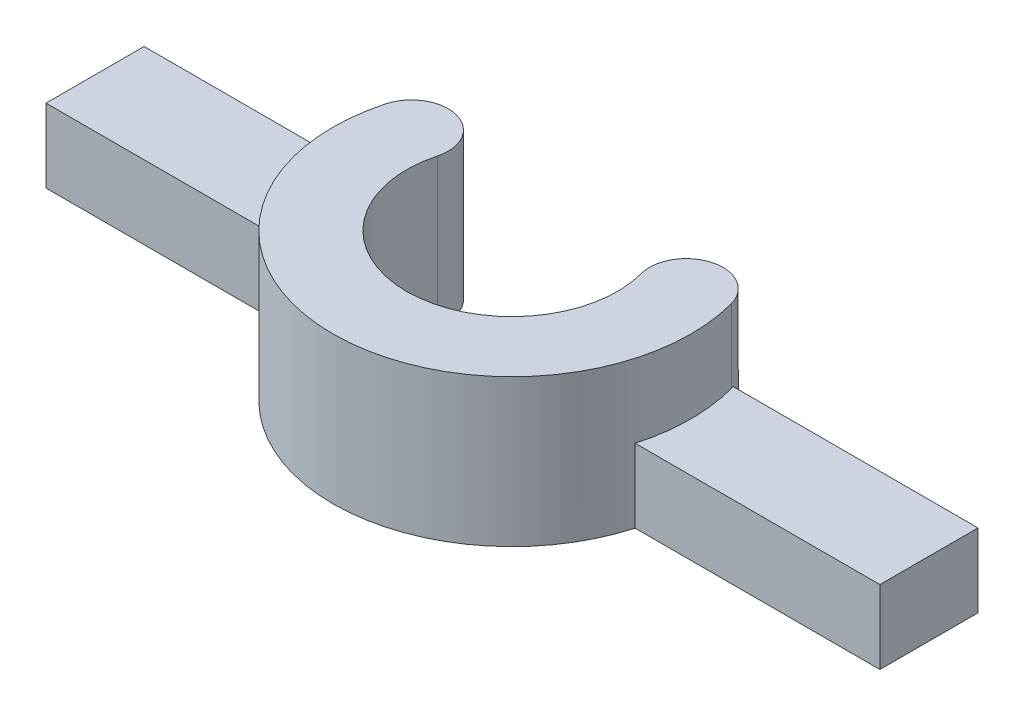
from build123d import *

# Parameters (mm, degrees)
SKETCH1_W                = 30
SKETCH1_H                = 30
BOSS_EXTRUDE1_DEPTH      = 5
SKETCH2_W                = 10
SKETCH2_H                = 10
BOSS_EXTRUDE2_DEPTH      = 50
SKETCH3_W                = 10
SKETCH3_H                = 3
SKETCH3_W_2              = 5
SKETCH3_H_2              = 7
SKETCH3_H_3              = 5
BOSS_EXTRUDE3_DEPTH      = 2
BOSS_EXTRUDE4_DEPTH      = 3
BOSS_EXTRUDE4_DEPTH_BACK = 5
SKETCH4_R                = 7.3
SKETCH4_R_2              = 4.3
CUT_EXTRUDE1_DEPTH       = 6
CUT_EXTRUDE1_DEPTH_BACK  = 5
SKETCH6_R                = 4.3
FILLET1_R                = 1.5
FILLET2_R                = 1.5
FILLET3_R                = 2
SKETCH7_W                = 39.438883959
SKETCH7_H                = 36.533940166
CUT_EXTRUDE2_DEPTH       = 80
SKETCH8_W                = 4
SKETCH8_H                = 3
BOSS_EXTRUDE5_DEPTH      = 2


with BuildPart() as part:
    # Sketch1 → Boss-Extrude1 (new body)
    with BuildSketch(Plane(origin=(0, 0, 0), x_dir=(1, 0, 0), z_dir=(0, 1, 0))):
        Rectangle(SKETCH1_W, SKETCH1_H)
    extrude(amount=BOSS_EXTRUDE1_DEPTH)

    # Sketch2 → Boss-Extrude2 (add)
    with BuildSketch(Plane(origin=(0, 5, 0), x_dir=(1, 0, 0), z_dir=(0, 1, 0))):
        Rectangle(SKETCH2_W, SKETCH2_H)
    extrude(amount=BOSS_EXTRUDE2_DEPTH)

    # Sketch3 → Boss-Extrude3 (add, symmetric)
    with BuildSketch(Plane.XY):
        with Locations((-5, 63.5)):
            Rectangle(SKETCH3_W, SKETCH3_H)
        with Locations((-12.5, 63.5)):
            Rectangle(SKETCH3_W_2, SKETCH3_H)
        with Locations((-12.5, 58.5)):
            Rectangle(SKETCH3_W_2, SKETCH3_H_2)
        with Locations((-12.5, 52.5)):
            Rectangle(SKETCH3_W_2, SKETCH3_H_3)
        with Locations((-7.5, 52.5)):
            Rectangle(SKETCH3_W_2, SKETCH3_H_3)
    boss_extrude3 = extrude(amount=BOSS_EXTRUDE3_DEPTH, both=True)

    # Mirror1: Boss-Extrude3 across plane
    add(boss_extrude3.mirror(Plane(origin=(0, 0, 0), x_dir=(0, 0, 1), z_dir=(1, 0, 0))))

    # Sketch4 → Boss-Extrude4 (add, two sides: drawn at the far end of the back side and taken through both)
    with BuildSketch(Plane(origin=(0, 65, 0), x_dir=(1, 0, 0), z_dir=(0, 1, 0)).offset(-BOSS_EXTRUDE4_DEPTH_BACK)):
        with Locations(Location((0, 0, 0), (0, 0, 270))):
            Circle(SKETCH4_R)
        with Locations(Location((0, 0, 0), (0, 0, 270))):
            Circle(SKETCH4_R_2, mode=Mode.SUBTRACT)
    extrude(amount=BOSS_EXTRUDE4_DEPTH + BOSS_EXTRUDE4_DEPTH_BACK)

    # Sketch6 → Cut-Extrude1 (cut, two sides: drawn at the far end of the back side and taken through both)
    with BuildSketch(Plane(origin=(0, 65, 0), x_dir=(1, 0, 0), z_dir=(0, 1, 0)).offset(-CUT_EXTRUDE1_DEPTH_BACK)):
        Circle(SKETCH6_R)
        with BuildLine():
            Line((-6.321985448, 3.65), (0, 0))
            Line((0, 0), (6.321985448, 3.65))
            ThreePointArc((6.321985448, 3.65), (0, 7.3), (-6.321985448, 3.65))
        make_face()
    extrude(amount=CUT_EXTRUDE1_DEPTH + CUT_EXTRUDE1_DEPTH_BACK, mode=Mode.SUBTRACT)

    # Fillet1
    # the kernel refuses this fillet: 1.5 mm, written as the material it takes off along each edge
    with BuildSketch(Plane(origin=(6.321985448, 55.239509531, -3.65), x_dir=(0.3827782883031586, 1.5487943038784236e-14, 0.923840236190059), z_dir=(0, 1, 0))) as fillet1_piece_1_section:
        with BuildLine():
            CenterArc((1.708559593, -1.487187387), FILLET1_R, 82.505882759, 104.988234482)
            Line((0.221372206, -1.682823981), (0, 0))
            ThreePointArc((0, 0), (0.952098094, 0.062354719), (1.904196188, 0))
        make_face()
    fillet1_piece_1 = extrude(amount=17.520980938, mode=Mode.PRIVATE)
    fillet1_piece_1 = split(fillet1_piece_1, bisect_by=Plane(origin=(7.049867501, 58.619754766, -2), z_dir=(0, 0, 1)), keep=Keep.TOP, mode=Mode.PRIVATE)
    fillet1_piece_1 = split(fillet1_piece_1, bisect_by=Plane(origin=(7.049867501, 62, -1.948339527), z_dir=(0, -1, 0)), keep=Keep.TOP, mode=Mode.PRIVATE)
    add(fillet1_piece_1, mode=Mode.SUBTRACT)
    with BuildSketch(Plane(origin=(6.321985448, 55.239509531, -3.65), x_dir=(0.3827782883031586, 1.5487943038784236e-14, 0.923840236190059), z_dir=(0, 1, 0))) as fillet1_piece_2_section:
        with BuildLine():
            CenterArc((1.708559593, -1.487187387), FILLET1_R, 82.505882759, 104.988234482)
            Line((0.221372206, -1.682823981), (0, 0))
            ThreePointArc((0, 0), (0.952098094, 0.062354719), (1.904196188, 0))
        make_face()
    fillet1_piece_2 = extrude(amount=17.520980938, mode=Mode.PRIVATE)
    fillet1_piece_2 = split(fillet1_piece_2, bisect_by=Plane(origin=(6.1871982, 58.619754766, -2), z_dir=(0, 0, -1)), keep=Keep.TOP, mode=Mode.PRIVATE)
    fillet1_piece_2 = split(fillet1_piece_2, bisect_by=Plane(origin=(6.1871982, 62, -3.070632647), z_dir=(0, -1, 0)), keep=Keep.TOP, mode=Mode.PRIVATE)
    add(fillet1_piece_2, mode=Mode.SUBTRACT)
    with BuildSketch(Plane(origin=(6.321985448, 55.239509531, -3.65), x_dir=(0.3827782883031586, 1.5487943038784236e-14, 0.923840236190059), z_dir=(0, 1, 0))) as fillet1_piece_3_section:
        with BuildLine():
            CenterArc((1.708559593, -1.487187387), FILLET1_R, 82.505882759, 104.988234482)
            Line((0.221372206, -1.682823981), (0, 0))
            ThreePointArc((0, 0), (0.952098094, 0.062354719), (1.904196188, 0))
        make_face()
    fillet1_piece_3 = extrude(amount=17.520980938, mode=Mode.PRIVATE)
    fillet1_piece_3 = split(fillet1_piece_3, bisect_by=Plane(origin=(6.1871982, 63.5, -2), z_dir=(0, 0, -1)), keep=Keep.TOP, mode=Mode.PRIVATE)
    fillet1_piece_3 = split(fillet1_piece_3, bisect_by=Plane(origin=(6.1871982, 65, -3.070632647), z_dir=(0, -1, 0)), keep=Keep.TOP, mode=Mode.PRIVATE)
    fillet1_piece_3 = split(fillet1_piece_3, bisect_by=Plane(origin=(6.1871982, 62, -3.070632647), z_dir=(0, 1, 0)), keep=Keep.TOP, mode=Mode.PRIVATE)
    add(fillet1_piece_3, mode=Mode.SUBTRACT)
    with BuildSketch(Plane(origin=(6.321985448, 55.239509531, -3.65), x_dir=(0.3827782883031586, 1.5487943038784236e-14, 0.923840236190059), z_dir=(0, 1, 0))) as fillet1_piece_4_section:
        with BuildLine():
            CenterArc((1.708559593, -1.487187387), FILLET1_R, 82.505882759, 104.988234482)
            Line((0.221372206, -1.682823981), (0, 0))
            ThreePointArc((0, 0), (0.952098094, 0.062354719), (1.904196188, 0))
        make_face()
    fillet1_piece_4 = extrude(amount=17.520980938, mode=Mode.PRIVATE)
    fillet1_piece_4 = split(fillet1_piece_4, bisect_by=Plane(origin=(7.049867501, 68.880245234, -2), z_dir=(0, 0, 1)), keep=Keep.TOP, mode=Mode.PRIVATE)
    fillet1_piece_4 = split(fillet1_piece_4, bisect_by=Plane(origin=(7.049867501, 65, -1.948339527), z_dir=(0, 1, 0)), keep=Keep.TOP, mode=Mode.PRIVATE)
    add(fillet1_piece_4, mode=Mode.SUBTRACT)
    with BuildSketch(Plane(origin=(6.321985448, 55.239509531, -3.65), x_dir=(0.3827782883031586, 1.5487943038784236e-14, 0.923840236190059), z_dir=(0, 1, 0))) as fillet1_piece_5_section:
        with BuildLine():
            CenterArc((1.708559593, -1.487187387), FILLET1_R, 82.505882759, 104.988234482)
            Line((0.221372206, -1.682823981), (0, 0))
            ThreePointArc((0, 0), (0.952098094, 0.062354719), (1.904196188, 0))
        make_face()
    fillet1_piece_5 = extrude(amount=17.520980938, mode=Mode.PRIVATE)
    fillet1_piece_5 = split(fillet1_piece_5, bisect_by=Plane(origin=(6.1871982, 68.880245234, -2), z_dir=(0, 0, -1)), keep=Keep.TOP, mode=Mode.PRIVATE)
    fillet1_piece_5 = split(fillet1_piece_5, bisect_by=Plane(origin=(6.1871982, 65, -3.070632647), z_dir=(0, 1, 0)), keep=Keep.TOP, mode=Mode.PRIVATE)
    add(fillet1_piece_5, mode=Mode.SUBTRACT)
    with BuildSketch(Plane(origin=(3.723909236, 56.743305172, -2.15), x_dir=(0.38277828830315935, 0, 0.9238402361900588), z_dir=(0, 1, 0))) as fillet1_piece_6:
        with BuildLine():
            CenterArc((1.317286404, 1.487187387), FILLET1_R, 187.494117241, 75.011765518)
            Line((-0.169900983, 1.291550792), (0, 0))
            ThreePointArc((0, 0), (0.560824905, 0.036729492), (1.121649809, 0))
        make_face()
    extrude(amount=14.513389656, mode=Mode.SUBTRACT)

    # Fillet2
    # the kernel refuses this fillet: 1.5 mm, written as the material it takes off along each edge
    with BuildSketch(Plane(origin=(-3.723909236, 71.256694828, -2.15), x_dir=(-0.38277828830315846, 0, 0.923840236190059), z_dir=(0, -1, 0))) as fillet2_piece_1:
        with BuildLine():
            CenterArc((1.317286404, 1.487187387), FILLET2_R, 187.494117241, 75.011765518)
            Line((-0.169900983, 1.291550792), (0, 0))
            ThreePointArc((0, 0), (0.560824905, 0.036729492), (1.121649809, 0))
        make_face()
    extrude(amount=14.513389656, mode=Mode.SUBTRACT)
    with BuildSketch(Plane(origin=(-6.321985448, 72.760490469, -3.65), x_dir=(0.8660254037844403, 0, 0.4999999999999975), z_dir=(0, -1, 0))) as fillet2_piece_2_section:
        with BuildLine():
            CenterArc((1.697322069, 1.5), FILLET2_R, 165.011765518, 104.988234482)
            ThreePointArc((0.248353638, 1.887931034), (0.062354719, 0.952098094), (0, 0))
            Line((0, 0), (1.697322069, 0))
        make_face()
    fillet2_piece_2 = extrude(amount=17.520980938, mode=Mode.PRIVATE)
    fillet2_piece_2 = split(fillet2_piece_2, bisect_by=Plane(origin=(-6.1871982, 68.880245234, -2), z_dir=(0, 0, -1)), keep=Keep.TOP, mode=Mode.PRIVATE)
    fillet2_piece_2 = split(fillet2_piece_2, bisect_by=Plane(origin=(-6.1871982, 65, -3.070632647), z_dir=(0, 1, 0)), keep=Keep.TOP, mode=Mode.PRIVATE)
    add(fillet2_piece_2, mode=Mode.SUBTRACT)
    with BuildSketch(Plane(origin=(-6.321985448, 72.760490469, -3.65), x_dir=(0.8660254037844403, 0, 0.4999999999999975), z_dir=(0, -1, 0))) as fillet2_piece_3_section:
        with BuildLine():
            CenterArc((1.697322069, 1.5), FILLET2_R, 165.011765518, 104.988234482)
            ThreePointArc((0.248353638, 1.887931034), (0.062354719, 0.952098094), (0, 0))
            Line((0, 0), (1.697322069, 0))
        make_face()
    fillet2_piece_3 = extrude(amount=17.520980938, mode=Mode.PRIVATE)
    fillet2_piece_3 = split(fillet2_piece_3, bisect_by=Plane(origin=(-7.049867501, 68.880245234, -2), z_dir=(0, 0, 1)), keep=Keep.TOP, mode=Mode.PRIVATE)
    fillet2_piece_3 = split(fillet2_piece_3, bisect_by=Plane(origin=(-7.049867501, 65, -1.948339527), z_dir=(0, 1, 0)), keep=Keep.TOP, mode=Mode.PRIVATE)
    add(fillet2_piece_3, mode=Mode.SUBTRACT)
    with BuildSketch(Plane(origin=(-6.321985448, 72.760490469, -3.65), x_dir=(0.8660254037844403, 0, 0.4999999999999975), z_dir=(0, -1, 0))) as fillet2_piece_4_section:
        with BuildLine():
            CenterArc((1.697322069, 1.5), FILLET2_R, 165.011765518, 104.988234482)
            ThreePointArc((0.248353638, 1.887931034), (0.062354719, 0.952098094), (0, 0))
            Line((0, 0), (1.697322069, 0))
        make_face()
    fillet2_piece_4 = extrude(amount=17.520980938, mode=Mode.PRIVATE)
    fillet2_piece_4 = split(fillet2_piece_4, bisect_by=Plane(origin=(-6.1871982, 62, -3.070632647), z_dir=(0, 1, 0)), keep=Keep.TOP, mode=Mode.PRIVATE)
    fillet2_piece_4 = split(fillet2_piece_4, bisect_by=Plane(origin=(-6.1871982, 63.5, -2), z_dir=(0, 0, -1)), keep=Keep.TOP, mode=Mode.PRIVATE)
    fillet2_piece_4 = split(fillet2_piece_4, bisect_by=Plane(origin=(-6.1871982, 65, -3.070632647), z_dir=(0, -1, 0)), keep=Keep.TOP, mode=Mode.PRIVATE)
    add(fillet2_piece_4, mode=Mode.SUBTRACT)
    with BuildSketch(Plane(origin=(-6.321985448, 72.760490469, -3.65), x_dir=(0.8660254037844403, 0, 0.4999999999999975), z_dir=(0, -1, 0))) as fillet2_piece_5_section:
        with BuildLine():
            CenterArc((1.697322069, 1.5), FILLET2_R, 165.011765518, 104.988234482)
            ThreePointArc((0.248353638, 1.887931034), (0.062354719, 0.952098094), (0, 0))
            Line((0, 0), (1.697322069, 0))
        make_face()
    fillet2_piece_5 = extrude(amount=17.520980938, mode=Mode.PRIVATE)
    fillet2_piece_5 = split(fillet2_piece_5, bisect_by=Plane(origin=(-6.1871982, 62, -3.070632647), z_dir=(0, -1, 0)), keep=Keep.TOP, mode=Mode.PRIVATE)
    fillet2_piece_5 = split(fillet2_piece_5, bisect_by=Plane(origin=(-6.1871982, 58.619754766, -2), z_dir=(0, 0, -1)), keep=Keep.TOP, mode=Mode.PRIVATE)
    add(fillet2_piece_5, mode=Mode.SUBTRACT)
    with BuildSketch(Plane(origin=(-6.321985448, 72.760490469, -3.65), x_dir=(0.8660254037844403, 0, 0.4999999999999975), z_dir=(0, -1, 0))) as fillet2_piece_6_section:
        with BuildLine():
            CenterArc((1.697322069, 1.5), FILLET2_R, 165.011765518, 104.988234482)
            ThreePointArc((0.248353638, 1.887931034), (0.062354719, 0.952098094), (0, 0))
            Line((0, 0), (1.697322069, 0))
        make_face()
    fillet2_piece_6 = extrude(amount=17.520980938, mode=Mode.PRIVATE)
    fillet2_piece_6 = split(fillet2_piece_6, bisect_by=Plane(origin=(-7.049867501, 62, -1.948339527), z_dir=(0, -1, 0)), keep=Keep.TOP, mode=Mode.PRIVATE)
    fillet2_piece_6 = split(fillet2_piece_6, bisect_by=Plane(origin=(-7.049867501, 58.619754766, -2), z_dir=(0, 0, 1)), keep=Keep.TOP, mode=Mode.PRIVATE)
    add(fillet2_piece_6, mode=Mode.SUBTRACT)

    # Fillet3
    fillet3_edges = [part.edges().sort_by_distance(p)[0] for p in [
        (0, 0, -15),
        (15, 0, 0),
        (0, 0, 15),
        (-15, 0, 0),
    ]]
    fillet(fillet3_edges, radius=FILLET3_R)

    # Sketch7 → Cut-Extrude2 (cut)
    with BuildSketch(Plane.XZ.offset(-62)):
        with Locations((1.010233487, -0.46607454)):
            Rectangle(SKETCH7_W, SKETCH7_H)
    extrude(amount=CUT_EXTRUDE2_DEPTH, mode=Mode.SUBTRACT)

    # Sketch8 → Boss-Extrude5 (add)
    with BuildSketch(Plane.ZY.offset(15)):
        with Locations((0, 63.5)):
            Rectangle(SKETCH8_W, SKETCH8_H)
    boss_extrude5 = extrude(amount=BOSS_EXTRUDE5_DEPTH)

    # Mirror3: Boss-Extrude5 across plane
    add(boss_extrude5.mirror(Plane(origin=(0, 0, 0), x_dir=(0, 0, 1), z_dir=(1, 0, 0))))


solid = part.part
